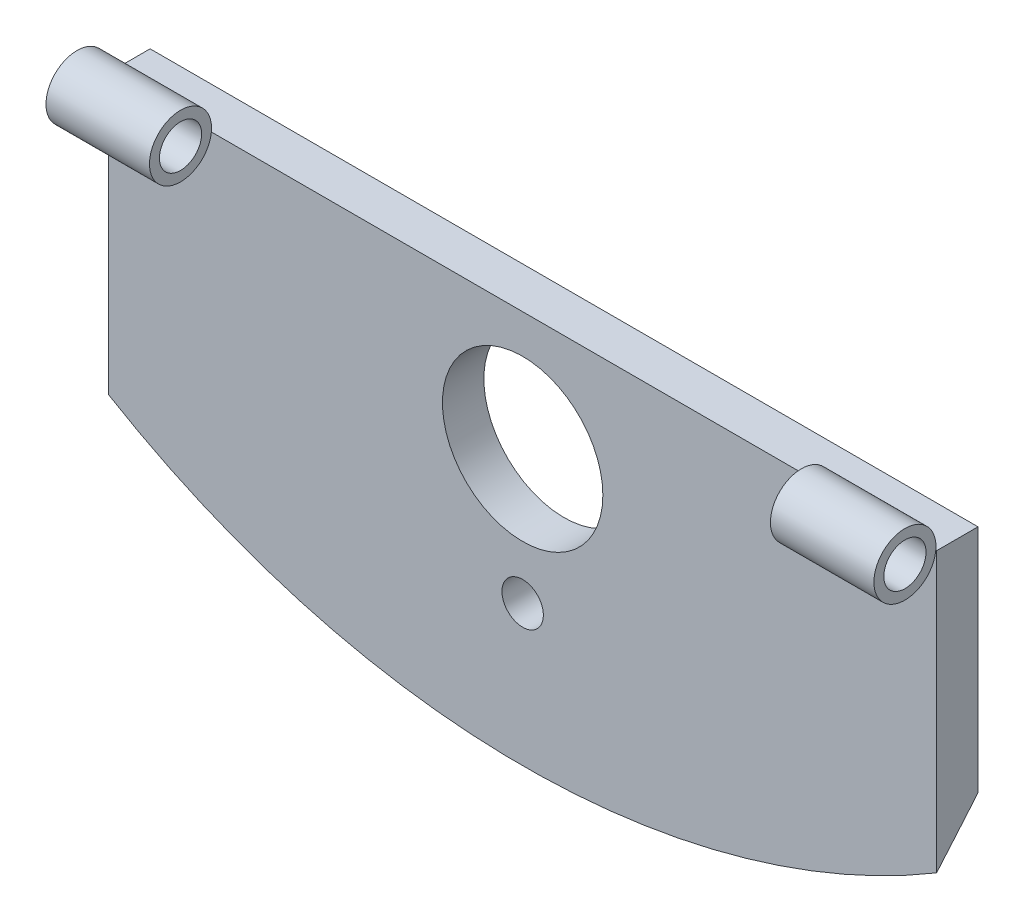
from build123d import *

# Parameters (mm, degrees)
BOSS_EXTRUDE1_DEPTH = 8
SKETCH2_R           = 15.5
CUT_EXTRUDE1_DEPTH  = 8
CHAMFER1_SIZE       = 8
SKETCH3_R           = 4
CUT_EXTRUDE2_DEPTH  = 60
SKETCH4_R           = 6
SKETCH4_R_2         = 4.079964081
BOSS_EXTRUDE2_DEPTH = 20
SKETCH5_R           = 6
SKETCH5_R_2         = 4.079964081
BOSS_EXTRUDE3_DEPTH = 20


with BuildPart() as part:
    # Sketch1 → Boss-Extrude1 (new body)
    with BuildSketch(Plane.XY):
        with BuildLine():
            Line((-80, 0), (-80, -53.925352342))
            ThreePointArc((-80, -53.925352342), (0, -76), (80, -53.925352342))
            Line((80, -53.925352342), (80, 0))
            Line((80, 0), (-80, 0))
        make_face()
    extrude(amount=BOSS_EXTRUDE1_DEPTH)

    # Sketch2 → Cut-Extrude1 (cut)
    with BuildSketch(Plane.XY.offset(8)):
        with Locations((0, -22.964297533)):
            Circle(SKETCH2_R)
    extrude(amount=-CUT_EXTRUDE1_DEPTH, mode=Mode.SUBTRACT)

    # Chamfer1
    chamfer1_edges = [part.edges().sort_by_distance(p)[0] for p in [
        (0, -76, 0),
    ]]
    chamfer(chamfer1_edges, length=CHAMFER1_SIZE - 0.0001)  # a hair under: the kernel refuses the full size

    # Sketch3 → Cut-Extrude2 (cut)
    with BuildSketch(Plane.XY.offset(8)):
        with Locations((0, -48.806594288)):
            Circle(SKETCH3_R)
    extrude(amount=-CUT_EXTRUDE2_DEPTH, mode=Mode.SUBTRACT)


with BuildPart() as body_2:
    # Sketch4 → Boss-Extrude2 (new body)
    with BuildSketch(Plane.ZY.offset(80)):
        with Locations(Location((14.122386973, 0.782069774, 0), (0, 0, 270))):
            Circle(SKETCH4_R)
        with Locations(Location((14.122386973, 0.782069774, 0), (0, 0, 270))):
            Circle(SKETCH4_R_2, mode=Mode.SUBTRACT)
    extrude(amount=-BOSS_EXTRUDE2_DEPTH)


with BuildPart() as body_3:
    # Sketch5 → Boss-Extrude3 (new body)
    with BuildSketch(Plane(origin=(80, 0, 0), x_dir=(0, 0, -1), z_dir=(1, 0, 0))):
        with Locations((-14.122386973, 0.782069774)):
            Circle(SKETCH5_R)
        with Locations((-14.122386973, 0.782069774)):
            Circle(SKETCH5_R_2, mode=Mode.SUBTRACT)
    extrude(amount=-BOSS_EXTRUDE3_DEPTH)


solid = Compound([part.part, body_2.part, body_3.part])
